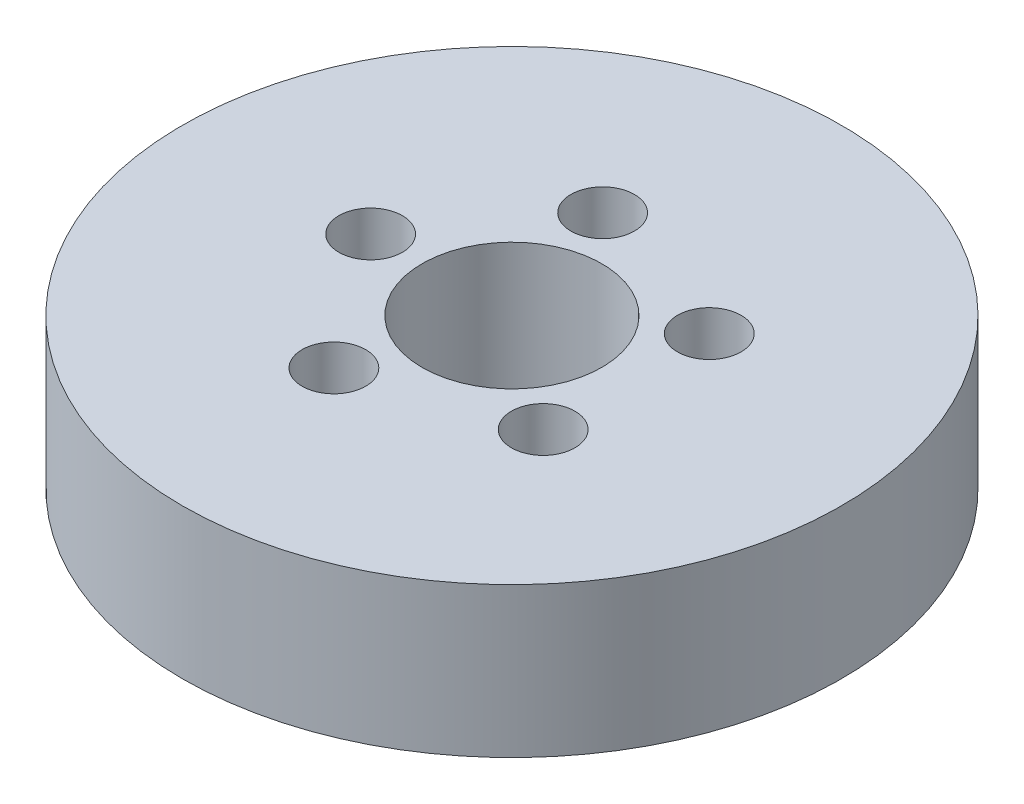
from build123d import *

# Parameters (mm, degrees)
SKETCH1_R           = 55
BOSS_EXTRUDE1_DEPTH = 25
SKETCH2_R           = 15
CUT_EXTRUDE1_DEPTH  = 82.700673192
SKETCH3_R           = 5.303136159
CUT_EXTRUDE2_DEPTH  = 18.019259147
CIRPATTERN1_COUNT   = 5


with BuildPart() as part:
    # Sketch1 → Boss-Extrude1 (new body)
    with BuildSketch(Plane(origin=(0, 0, 0), x_dir=(1, 0, 0), z_dir=(0, 1, 0))):
        Circle(SKETCH1_R)
    extrude(amount=BOSS_EXTRUDE1_DEPTH)

    # Sketch2 → Cut-Extrude1 (cut, through all)
    with BuildSketch(Plane(origin=(0, 0, 0), x_dir=(1, 0, 0), z_dir=(0, 1, 0))):
        Circle(SKETCH2_R)
    extrude(amount=CUT_EXTRUDE1_DEPTH, mode=Mode.SUBTRACT)

    # Sketch3 → Cut-Extrude2 (cut)
    with BuildSketch(Plane(origin=(0, 25, 0), x_dir=(1, 0, 0), z_dir=(0, 1, 0))):
        with Locations((-23.579581784, 0)):
            Circle(SKETCH3_R)
    cut_extrude2 = extrude(amount=-CUT_EXTRUDE2_DEPTH, mode=Mode.SUBTRACT)

    # CirPattern1: Cut-Extrude2 ×5 about axis
    cirpattern1_axis = Axis((0, 0, 0), (0, 1, 0))
    for i in range(1, CIRPATTERN1_COUNT):
        add(cut_extrude2.rotate(cirpattern1_axis, i * 360 / CIRPATTERN1_COUNT), mode=Mode.SUBTRACT)


solid = part.part
